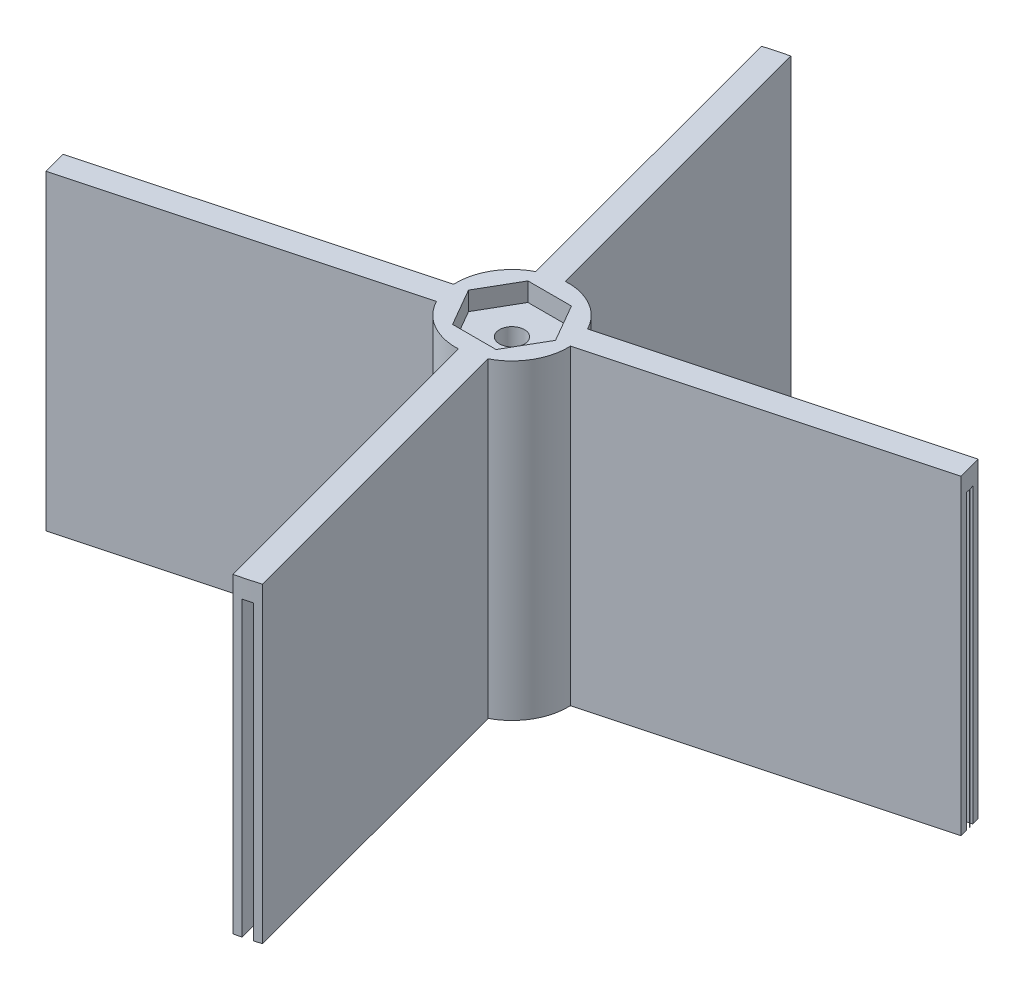
from build123d import *
from build123d.topology import SkipClean

# Parameters (mm, degrees)
SKETCH_1_R          = 60
SKETCH_1_R_2        = 2
EXTRUDE_1_DEPTH     = 6
CUT_EXTRUDE_1_DEPTH = 3
CUT_EXTRUDE_START   = -6
CUT_EXTRUDE_2_DEPTH = 6
EXTRUDE_START       = -50
EXTRUDE_2_DEPTH     = 50
SKETCH_4_4_R        = 9
SKETCH_4_4_R_2      = 7
EXTRUDE_3_DEPTH     = 50
CUT_EXTRUDE_4_DEPTH = 47


# Read off the part's stored shape, not the designer's step: 切除-拉伸2
with BuildPart() as part:
    # 草图1 → 凸台-拉伸1 (new body)
    with BuildSketch(Plane(origin=(0, 0, 0), x_dir=(1, 0, 0), z_dir=(0, 1, 0))):
        with Locations(Location((0, 0, 0), (0, 0, 270))):
            Circle(SKETCH_1_R)
        with Locations(Location((0, 0, 0), (0, 0, 270))):
            Circle(SKETCH_1_R_2, mode=Mode.SUBTRACT)
    extrude(amount=EXTRUDE_1_DEPTH)

    # 草图2 → 切除-拉伸1 (cut)
    with BuildSketch(Plane(origin=(0, 6, 0), x_dir=(1, 0, 0), z_dir=(0, 1, 0))):
        Polygon((-3.492969129, -6.05), (3.492969129, -6.05), (6.985938257, 0), (3.492969129, 6.05), (-3.492969129, 6.05), (-6.985938257, 0), align=None)
    extrude(amount=-CUT_EXTRUDE_1_DEPTH, mode=Mode.SUBTRACT)

    # 切除-拉伸2 outline → 切除-拉伸2 (cut)
    with BuildSketch(Plane(origin=(0, 6, 0), x_dir=(1, 0, 0), z_dir=(0, 1, 0)).offset(CUT_EXTRUDE_START)):
        with BuildLine():
            ThreePointArc((-0.399423258, 8.991132357), (4.5, 7.794228634), (7.986260659, 4.14965549))
            Line((7.986260659, 4.14965549), (57.42161539, 17.399944999))
            ThreePointArc((57.42161539, 17.399944999), (30, 51.961524227), (-13.642013302, 58.428550154))
            Line((-13.642013302, 58.428550154), (-0.399423258, 8.991132357))
        make_face()
        with BuildLine():
            ThreePointArc((17.391001663, -57.424324647), (51.961524227, -30), (58.426424771, 13.651113086))
            Line((58.426424771, 13.651113086), (8.99107004, 0.400823577))
            ThreePointArc((8.99107004, 0.400823577), (7.794228634, -4.5), (4.14841162, -7.98690685))
            Line((4.14841162, -7.98690685), (17.391001663, -57.424324647))
        make_face()
        with BuildLine():
            Line((-4.14841162, 7.98690685), (-17.391001663, 57.424324647))
            ThreePointArc((-17.391001663, 57.424324647), (-51.961524227, 30), (-58.426424771, -13.651113086))
            Line((-58.426424771, -13.651113086), (-8.99107004, -0.400823577))
            ThreePointArc((-8.99107004, -0.400823577), (-7.794228634, 4.5), (-4.14841162, 7.98690685))
        make_face()
        with BuildLine():
            Line((-7.986260659, -4.14965549), (-57.42161539, -17.399944999))
            ThreePointArc((-57.42161539, -17.399944999), (-30, -51.961524227), (13.642013302, -58.428550154))
            Line((13.642013302, -58.428550154), (0.399423258, -8.991132357))
            ThreePointArc((0.399423258, -8.991132357), (-4.5, -7.794228634), (-7.986260659, -4.14965549))
        make_face()
    extrude(amount=CUT_EXTRUDE_2_DEPTH, mode=Mode.SUBTRACT)

    # 草图4<3> → 凸台-拉伸2 (add)
    with BuildSketch(Plane(origin=(0, 6, 0), x_dir=(1, 0, 0), z_dir=(0, 1, 0)).offset(EXTRUDE_START)):
        with BuildLine():
            Line((8.99107004, 0.400823577), (58.426424771, 13.651113086))
            ThreePointArc((58.426424771, 13.651113086), (57.954340109, 15.5336558), (57.42161539, 17.399944999))
            Line((57.42161539, 17.399944999), (7.986260659, 4.14965549))
            ThreePointArc((7.986260659, 4.14965549), (8.693151016, 2.33004837), (8.99107004, 0.400823577))
        make_face()
        with BuildLine():
            Line((17.391001663, -57.424324647), (4.14841162, -7.98690685))
            ThreePointArc((4.14841162, -7.98690685), (2.328694427, -8.693513804), (0.399423258, -8.991132357))
            Line((0.399423258, -8.991132357), (13.642013302, -58.428550154))
            ThreePointArc((13.642013302, -58.428550154), (15.524629518, -57.956758694), (17.391001663, -57.424324647))
        make_face()
        with BuildLine():
            Line((-0.399423258, 8.991132357), (-13.642013302, 58.428550154))
            ThreePointArc((-13.642013302, 58.428550154), (-15.524629518, 57.956758694), (-17.391001663, 57.424324647))
            Line((-17.391001663, 57.424324647), (-4.14841162, 7.98690685))
            ThreePointArc((-4.14841162, 7.98690685), (-2.328694427, 8.693513804), (-0.399423258, 8.991132357))
        make_face()
        with BuildLine():
            Line((-57.42161539, -17.399944999), (-7.986260659, -4.14965549))
            ThreePointArc((-7.986260659, -4.14965549), (-8.693151016, -2.33004837), (-8.99107004, -0.400823577))
            Line((-8.99107004, -0.400823577), (-58.426424771, -13.651113086))
            ThreePointArc((-58.426424771, -13.651113086), (-57.954340109, -15.5336558), (-57.42161539, -17.399944999))
        make_face()
    extrude(amount=EXTRUDE_2_DEPTH)

    # 草图4<4> → 凸台-拉伸3 (add)
    with SkipClean():  # the faces are left unmerged after this step: merging them gives an invalid solid
        with BuildSketch(Plane(origin=(0, 6, 0), x_dir=(1, 0, 0), z_dir=(0, 1, 0)).offset(EXTRUDE_START)):
            Circle(SKETCH_4_4_R)
            with Locations(Location((0, 0, 0), (0, 0, 270))):
                Circle(SKETCH_4_4_R_2, mode=Mode.SUBTRACT)
        extrude(amount=EXTRUDE_3_DEPTH)
    add(part.part.scale(1), mode=Mode.REPLACE)  # the faces are merged on a copy

    # 草图5 → 切除-拉伸4 (cut)
    with SkipClean():  # the faces are left unmerged after this step: merging them gives an invalid solid
        with BuildSketch(Plane.XZ.offset(44)):
            with BuildLine():
                Line((3.295692014, 9.441314217), (16.239993631, 57.765157595))
                Line((16.239993631, 57.765157595), (14.809275617, 58.148397921))
                Line((14.809275617, 58.148397921), (1.864974, 9.824554544))
                ThreePointArc((1.864974, 9.824554544), (2.587438253, 9.659459782), (3.295692014, 9.441314217))
            make_face()
            with BuildLine():
                Line((58.146042416, -14.818318801), (9.824263964, -1.866504102))
                ThreePointArc((9.824263964, -1.866504102), (9.659056685, -2.588942633), (9.440800816, -3.29716241))
                Line((9.440800816, -3.29716241), (57.762579268, -16.24897711))
                Line((57.762579268, -16.24897711), (58.146042416, -14.818318801))
            make_face()
            with BuildLine():
                ThreePointArc((-9.824263964, 1.866504102), (-9.659056685, 2.588942633), (-9.440800816, 3.29716241))
                Line((-9.440800816, 3.29716241), (-57.762579268, 16.24897711))
                Line((-57.762579268, 16.24897711), (-58.146042416, 14.818318801))
                Line((-58.146042416, 14.818318801), (-9.824263964, 1.866504102))
            make_face()
            with BuildLine():
                Line((-14.809275617, -58.148397921), (-1.864974, -9.824554544))
                ThreePointArc((-1.864974, -9.824554544), (-2.587438253, -9.659459782), (-3.295692014, -9.441314217))
                Line((-3.295692014, -9.441314217), (-16.239993631, -57.765157595))
                Line((-16.239993631, -57.765157595), (-14.809275617, -58.148397921))
            make_face()
        extrude(amount=-CUT_EXTRUDE_4_DEPTH, mode=Mode.SUBTRACT)


solid = part.part
